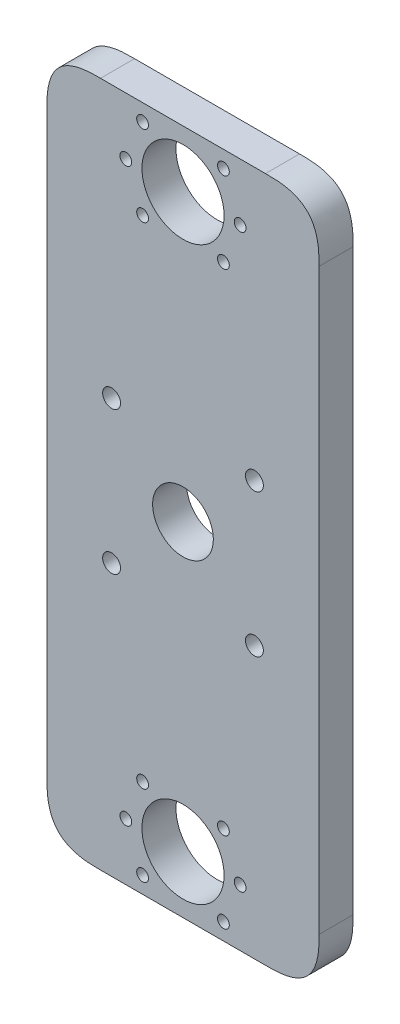
from build123d import *

# Parameters (mm, degrees)
SKETCH2_W                     = 76.2
SKETCH2_H                     = 192
BOSS_EXTRUDE1_DEPTH           = 9.525
M16_CLEARANCE_HOLE1_D         = 17
M4X0_7_TAPPED_HOLE1_D         = 3.3
SKETCH9_R                     = 11.5
CUT_EXTRUDE1_DEPTH            = 179.996240317
FILLET1_SIZE                  = 15
M6X1_0_START                  = -94
M6X1_0_TAPPED_HOLE1_OUTLINE_R = 2.5
M6X1_0_TAPPED_HOLE1_DEPTH     = 12


with BuildPart() as part:
    # Sketch2 → Boss-Extrude1 (new body)
    with BuildSketch(Plane(origin=(0, 0, -83.092064992), x_dir=(-1, 0, 0), z_dir=(0, 0, -1))):
        with Locations((10.260528885, 76.076110104)):
            Rectangle(SKETCH2_W, SKETCH2_H)
    extrude(amount=BOSS_EXTRUDE1_DEPTH)

    # M16 Clearance Hole1 (through all)
    with Locations(Plane.XY.offset(-83.092064992)):
        with Locations((-10.260528885, 76.076110104)):
            Hole(M16_CLEARANCE_HOLE1_D / 2)

    # M4x0.7 Tapped Hole1 (through all)
    with Locations(Plane.XY.offset(-83.092064992)):
        with Locations((-21.574237384, 144.762401605), (-26.260528885, 156.076110104), (-21.574237384, 167.389818603), (1.053179614, 144.762401605), (5.739471115, 156.076110104), (1.053179614, 167.389818603), (1.053179614, 7.389818603), (1.053179614, -15.237598395), (-21.574237384, -15.237598395), (-26.260528885, -3.923889896), (-21.574237384, 7.389818603), (5.739471115, -3.923889896)):
            Hole(M4X0_7_TAPPED_HOLE1_D / 2)

    # Sketch9 → Cut-Extrude1 (cut, through all)
    with BuildSketch(Plane.XY.offset(-83.092064992)):
        with Locations((-10.260528885, 156.076110104)):
            Circle(SKETCH9_R)
        with Locations((-10.260528885, -3.923889896)):
            Circle(SKETCH9_R)
    extrude(amount=-CUT_EXTRUDE1_DEPTH, mode=Mode.SUBTRACT)

    # Fillet1
    # a fillet whose section is not a circle: 15 mm, written as the material it takes off along each edge
    with BuildSketch(Plane(origin=(27.839471115, 172.076110104, -45.592064992), x_dir=(0, -1, 0), z_dir=(0, 0, -1)), Plane(origin=(27.839471115, -19.923889896, -45.592064992), x_dir=(-1, 0, 0), z_dir=(0, 0, -1))) as fillet1_piece_1:
        with BuildLine():
            add(Edge.make_bspline([(FILLET1_SIZE, 0), (FILLET1_SIZE * 0.831801948466, 0), (FILLET1_SIZE * 0.663603896932, 0), (FILLET1_SIZE * 0.292893218813, FILLET1_SIZE * 0.0716919198361), (FILLET1_SIZE * 0.0716919198361, FILLET1_SIZE * 0.292893218813), (0, FILLET1_SIZE * 0.663603896932), (0, FILLET1_SIZE * 0.831801948466), (0, FILLET1_SIZE)], knots=[0, 0, 0, 0, 0, 0, 0.5, 0.5, 1, 1, 1, 1, 1, 1], degree=5))
            Line((0, FILLET1_SIZE), (0, 0))
            Line((0, 0), (FILLET1_SIZE, 0))
        make_face()
    extrude(amount=84.525, mode=Mode.SUBTRACT)
    with BuildSketch(Plane(origin=(-48.360528885, -19.923889896, -45.592064992), x_dir=(1, 0, 0), z_dir=(0, 0, -1)), Plane(origin=(-48.360528885, 172.076110104, -45.592064992), x_dir=(0, -1, 0), z_dir=(0, 0, -1))) as fillet1_piece_2:
        with BuildLine():
            add(Edge.make_bspline([(FILLET1_SIZE, 0), (FILLET1_SIZE * 0.831801948466, 0), (FILLET1_SIZE * 0.663603896932, 0), (FILLET1_SIZE * 0.292893218813, -FILLET1_SIZE * 0.0716919198361), (FILLET1_SIZE * 0.0716919198361, -FILLET1_SIZE * 0.292893218813), (0, -FILLET1_SIZE * 0.663603896932), (0, -FILLET1_SIZE * 0.831801948466), (0, -FILLET1_SIZE)], knots=[0, 0, 0, 0, 0, 0, 0.5, 0.5, 1, 1, 1, 1, 1, 1], degree=5))
            Line((0, -FILLET1_SIZE), (0, 0))
            Line((0, 0), (FILLET1_SIZE, 0))
        make_face()
    extrude(amount=84.525, mode=Mode.SUBTRACT)

    # M6x1.0 Tapped Hole1: read off the stored shape, not the designer's step
    # M6x1.0 Tapped Hole1 outline → M6x1.0 Tapped Hole1 (cut)
    with BuildSketch(Plane.XY.offset(M6X1_0_START)):
        with Locations((-30.260528885, 96.076110104)):
            Circle(M6X1_0_TAPPED_HOLE1_OUTLINE_R)
        with Locations((9.739471115, 56.076110104)):
            Circle(M6X1_0_TAPPED_HOLE1_OUTLINE_R)
        with Locations((-30.260528885, 56.076110104)):
            Circle(M6X1_0_TAPPED_HOLE1_OUTLINE_R)
        with Locations((9.739471115, 96.076110104)):
            Circle(M6X1_0_TAPPED_HOLE1_OUTLINE_R)
    extrude(amount=M6X1_0_TAPPED_HOLE1_DEPTH, mode=Mode.SUBTRACT)


solid = part.part
